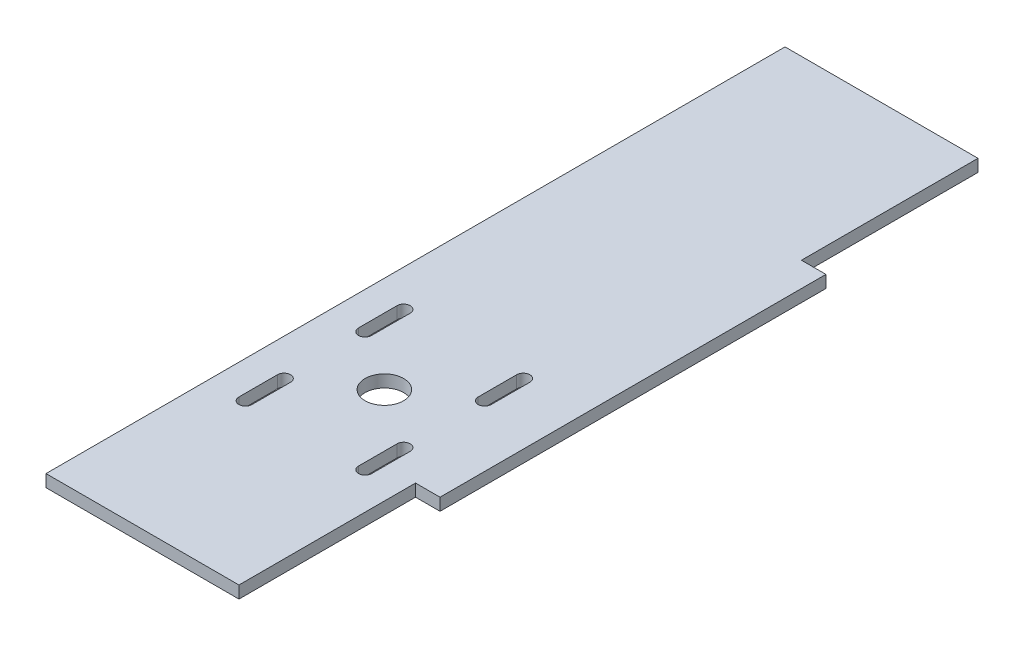
from build123d import *

# Parameters (mm, degrees)
BOSS_EXTRUDE1_DEPTH  = 3.175
SKETCH3_R            = 5
CUT_EXTRUDE1_DEPTH   = 150.117288149
M3_CLEARANCE_HOLE1_D = 3.4
CUT_EXTRUDE2_DEPTH   = 150.117288149


with BuildPart() as part:
    # Sketch1 → Boss-Extrude1 (new body)
    with BuildSketch(Plane(origin=(0, 0, 0), x_dir=(1, 0, 0), z_dir=(0, 1, 0))):
        Polygon((25, 45.75), (-25, 45.75), (-25, 0), (-25, -100), (-25, -145.75), (25, -145.75), (25, -100), (31.35, -100), (31.35, 0), (25, 0), align=None)
    extrude(amount=BOSS_EXTRUDE1_DEPTH)

    # Sketch3 → Cut-Extrude1 (cut, through all)
    with BuildSketch(Plane(origin=(0, 3.175, 0), x_dir=(1, 0, 0), z_dir=(0, 1, 0))):
        with Locations((0, -83.075)):
            Circle(SKETCH3_R)
    extrude(amount=-CUT_EXTRUDE1_DEPTH, mode=Mode.SUBTRACT)

    # M3 Clearance Hole1 (through all)
    with Locations(Plane(origin=(0, 3.175, 0), x_dir=(1, 0, 0), z_dir=(0, 1, 0))):
        with Locations((15.5, -98.575), (-15.5, -98.575), (-15.5, -67.575), (15.5, -67.575)):
            Hole(M3_CLEARANCE_HOLE1_D / 2)

    # Sketch6 → Cut-Extrude2 (cut, through all)
    with BuildSketch(Plane.XZ):
        with BuildLine():
            Line((17.2, 103.575), (17.2, 93.575))
            ThreePointArc((17.2, 93.575), (15.5, 91.875), (13.8, 93.575))
            Line((13.8, 93.575), (13.8, 103.575))
            ThreePointArc((13.8, 103.575), (15.5, 105.275), (17.2, 103.575))
        make_face()
        with BuildLine():
            Line((-13.8, 103.575), (-13.8, 93.575))
            ThreePointArc((-13.8, 93.575), (-15.5, 91.875), (-17.2, 93.575))
            Line((-17.2, 93.575), (-17.2, 103.575))
            ThreePointArc((-17.2, 103.575), (-15.5, 105.275), (-13.8, 103.575))
        make_face()
        with BuildLine():
            Line((17.2, 62.575), (17.2, 72.575))
            ThreePointArc((17.2, 72.575), (15.5, 74.275), (13.8, 72.575))
            Line((13.8, 72.575), (13.8, 62.575))
            ThreePointArc((13.8, 62.575), (15.5, 60.875), (17.2, 62.575))
        make_face()
        with BuildLine():
            Line((-13.8, 62.575), (-13.8, 72.575))
            ThreePointArc((-13.8, 72.575), (-15.5, 74.275), (-17.2, 72.575))
            Line((-17.2, 72.575), (-17.2, 62.575))
            ThreePointArc((-17.2, 62.575), (-15.5, 60.875), (-13.8, 62.575))
        make_face()
    extrude(amount=-CUT_EXTRUDE2_DEPTH, mode=Mode.SUBTRACT)


solid = part.part
